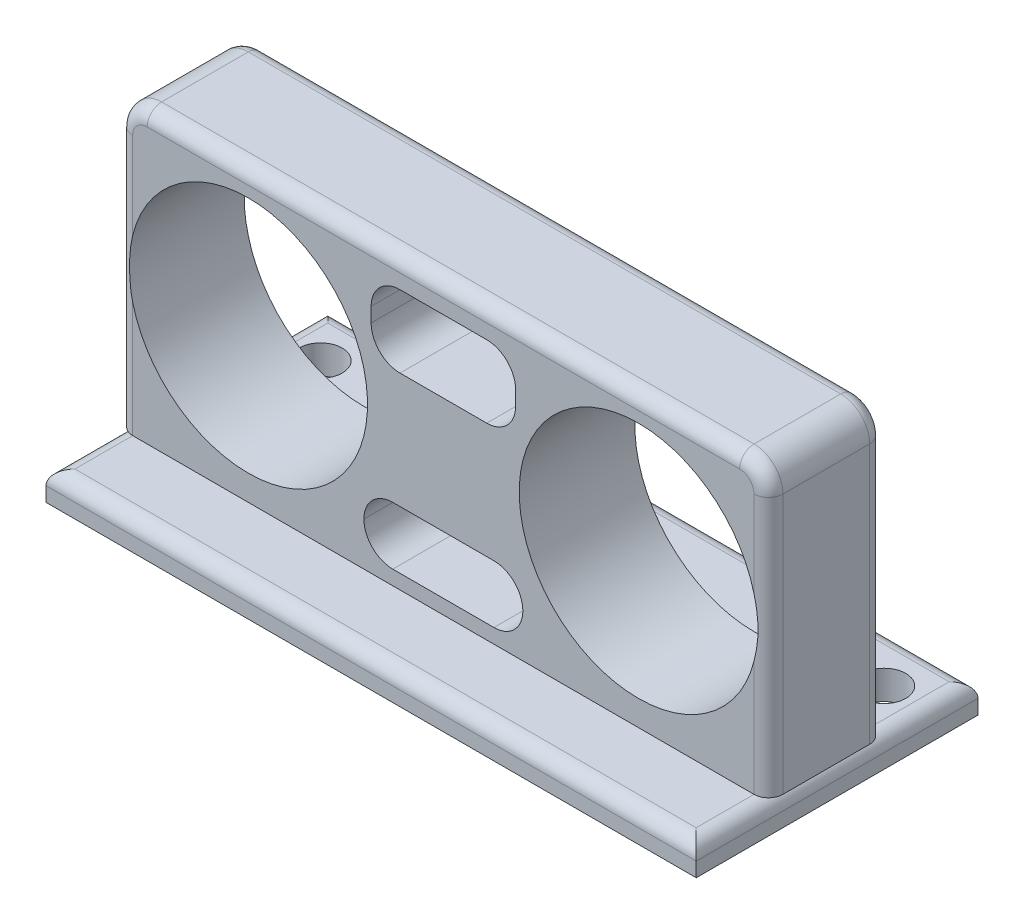
from build123d import *

# Parameters (mm, degrees)
CROQUIS1_W              = 45
CROQUIS1_H              = 20
CROQUIS1_R              = 8.25
SALIENTE_EXTRUIR1_DEPTH = 8
CROQUIS2_W              = 45
CROQUIS2_H              = 23
SALIENTE_EXTRUIR2_DEPTH = 2
CROQUIS4_W              = 11
CROQUIS4_H              = 4
CROQUIS4_W_2            = 10
CROQUIS4_H_2            = 5
CORTAR_EXTRUIR3_DEPTH   = 52.749396132
CROQUIS5_R              = 1.5
CORTAR_EXTRUIR4_DEPTH   = 51.931326313
REDONDEO1_R             = 2
REDONDEO2_R             = 2
REDONDEO3_R             = 1
CROQUIS6_W              = 45
CROQUIS6_H              = 3.5
CORTAR_EXTRUIR5_DEPTH   = 51.931326401
REDONDEO4_R             = 1


# Some blends are built 0.0001 mm under size
with BuildPart() as part:
    # Croquis1 → Saliente-Extruir1 (new body)
    with BuildSketch(Plane.XY):
        with Locations((22.5, -10)):
            Rectangle(CROQUIS1_W, CROQUIS1_H)
        with Locations((9, -10)):
            Circle(CROQUIS1_R, mode=Mode.SUBTRACT)
        with Locations((36, -10)):
            Circle(CROQUIS1_R, mode=Mode.SUBTRACT)
    extrude(amount=SALIENTE_EXTRUIR1_DEPTH)

    # Croquis4 → Cortar-Extruir3 (cut, through all)
    with BuildSketch(Plane(origin=(0, 0, 0), x_dir=(-1, 0, 0), z_dir=(0, 0, -1))):
        with Locations((-22.5, -17)):
            Rectangle(CROQUIS4_W, CROQUIS4_H)
        with Locations((-22.5, -4.5)):
            Rectangle(CROQUIS4_W_2, CROQUIS4_H_2)
    extrude(amount=-CORTAR_EXTRUIR3_DEPTH, mode=Mode.SUBTRACT)

    # Redondeo1
    redondeo1_edges = [part.edges().sort_by_distance(p)[0] for p in [
        (17, -19, 4),
        (28, -15, 4),
        (17, -15, 4),
        (28, -19, 4),
    ]]
    fillet(redondeo1_edges, radius=REDONDEO1_R - 0.0001)  # a hair under: the kernel refuses the full size

    # Redondeo2
    redondeo2_edges = [part.edges().sort_by_distance(p)[0] for p in [
        (17.5, -7, 4),
        (27.5, -7, 4),
        (27.5, -2, 4),
        (17.5, -2, 4),
        (0, 0, 4),
        (45, 0, 4),
    ]]
    fillet(redondeo2_edges, radius=REDONDEO2_R)

    # Redondeo3
    # the kernel refuses this fillet: 1 mm, written as the material it takes off along each edge
    with BuildSketch(Plane(origin=(45, -2, 8), x_dir=(0, 0, -1), z_dir=(0, -1, 0)), Plane(origin=(45, -2, 0), x_dir=(-1, 0, 0), z_dir=(0, -1, 0)), Plane(origin=(0, -22.5, 0), x_dir=(1, 0, 0), z_dir=(0, 1, 0)), Plane(origin=(0, -22.5, 8), x_dir=(0, 0, -1), z_dir=(0, 1, 0))) as redondeo3_piece_1:
        with BuildLine():
            CenterArc((REDONDEO3_R, -REDONDEO3_R), REDONDEO3_R, 90, 90)
            Line((0, -REDONDEO3_R), (0, 0))
            Line((0, 0), (REDONDEO3_R, 0))
        make_face()
    extrude(amount=20.5, mode=Mode.SUBTRACT)
    with BuildSketch(Plane(origin=(2, 0, 0), x_dir=(0, -1, 0), z_dir=(1, 0, 0)), Plane(origin=(2, 0, 8), x_dir=(0, 0, -1), z_dir=(1, 0, 0))) as redondeo3_piece_2:
        with BuildLine():
            CenterArc((REDONDEO3_R, -REDONDEO3_R), REDONDEO3_R, 90, 90)
            Line((0, -REDONDEO3_R), (0, 0))
            Line((0, 0), (REDONDEO3_R, 0))
        make_face()
    extrude(amount=41, mode=Mode.SUBTRACT)
    with BuildSketch(Plane(origin=(2, -2, 0), x_dir=(0, 1, 0), z_dir=(1, 0, 0))) as redondeo3_piece_3:
        with BuildLine():
            CenterArc((2 - REDONDEO3_R, REDONDEO3_R), REDONDEO3_R, 270, 90)
            Line((2, REDONDEO3_R), (2, 0))
            Line((2, 0), (2 - REDONDEO3_R, 0))
        make_face()
    revolve(axis=Axis((2, -2, 0), (0, 0, 1)), revolution_arc=90, mode=Mode.SUBTRACT)
    with BuildSketch(Plane(origin=(43, -2, 0), x_dir=(0, 1, 0), z_dir=(-1, 0, 0))) as redondeo3_piece_4:
        with BuildLine():
            CenterArc((2 - REDONDEO3_R, -REDONDEO3_R), REDONDEO3_R, 0, 90)
            Line((2, -REDONDEO3_R), (2, 0))
            Line((2, 0), (2 - REDONDEO3_R, 0))
        make_face()
    revolve(axis=Axis((43, -2, 0), (0, 0, -1)), revolution_arc=90, mode=Mode.SUBTRACT)
    with BuildSketch(Plane(origin=(2, -2, 8), x_dir=(0, 1, 0), z_dir=(1, 0, 0))) as redondeo3_piece_5:
        with BuildLine():
            CenterArc((2 - REDONDEO3_R, -REDONDEO3_R), REDONDEO3_R, 0, 90)
            Line((2 - REDONDEO3_R, 0), (2, 0))
            Line((2, 0), (2, -REDONDEO3_R))
        make_face()
    revolve(axis=Axis((2, -2, 8), (0, 0, 1)), revolution_arc=90, mode=Mode.SUBTRACT)
    with BuildSketch(Plane(origin=(43, -2, 8), x_dir=(0, 1, 0), z_dir=(-1, 0, 0))) as redondeo3_piece_6:
        with BuildLine():
            CenterArc((2 - REDONDEO3_R, REDONDEO3_R), REDONDEO3_R, 270, 90)
            Line((2 - REDONDEO3_R, 0), (2, 0))
            Line((2, 0), (2, REDONDEO3_R))
        make_face()
    revolve(axis=Axis((43, -2, 8), (0, 0, -1)), revolution_arc=90, mode=Mode.SUBTRACT)


with BuildPart() as body_2:
    # Croquis2 → Saliente-Extruir2 (new body)
    with BuildSketch(Plane(origin=(0, -20, 0), x_dir=(-1, 0, 0), z_dir=(0, -1, 0))):
        with Locations((-22.5, -1.5)):
            Rectangle(CROQUIS2_W, CROQUIS2_H)
    extrude(amount=SALIENTE_EXTRUIR2_DEPTH)

    # Croquis5 → Cortar-Extruir4 (cut, through all)
    with BuildSketch(Plane(origin=(0, -20, 0), x_dir=(1, 0, 0), z_dir=(0, 1, 0))):
        with Locations(Location((3, 3, 0), (0, 0, 270))):
            Circle(CROQUIS5_R)
        with Locations(Location((42, 3, 0), (0, 0, 270))):
            Circle(CROQUIS5_R)
    extrude(amount=-CORTAR_EXTRUIR4_DEPTH, mode=Mode.SUBTRACT)

    # Croquis6 → Cortar-Extruir5 (cut, through all)
    with BuildSketch(Plane(origin=(0, -20, 0), x_dir=(1, 0, 0), z_dir=(0, 1, 0))):
        with Locations((22.5, 8.25)):
            Rectangle(CROQUIS6_W, CROQUIS6_H)
    extrude(amount=-CORTAR_EXTRUIR5_DEPTH, mode=Mode.SUBTRACT)

    # Redondeo4
    redondeo4_edges = [body_2.edges().sort_by_distance(p)[0] for p in [
        (45, -20, 3.25),
        (22.5, -20, -6.5),
        (0, -20, 3.25),
        (22.5, -20, 13),
    ]]
    fillet(redondeo4_edges, radius=REDONDEO4_R)


solid = Compound([part.part, body_2.part])
